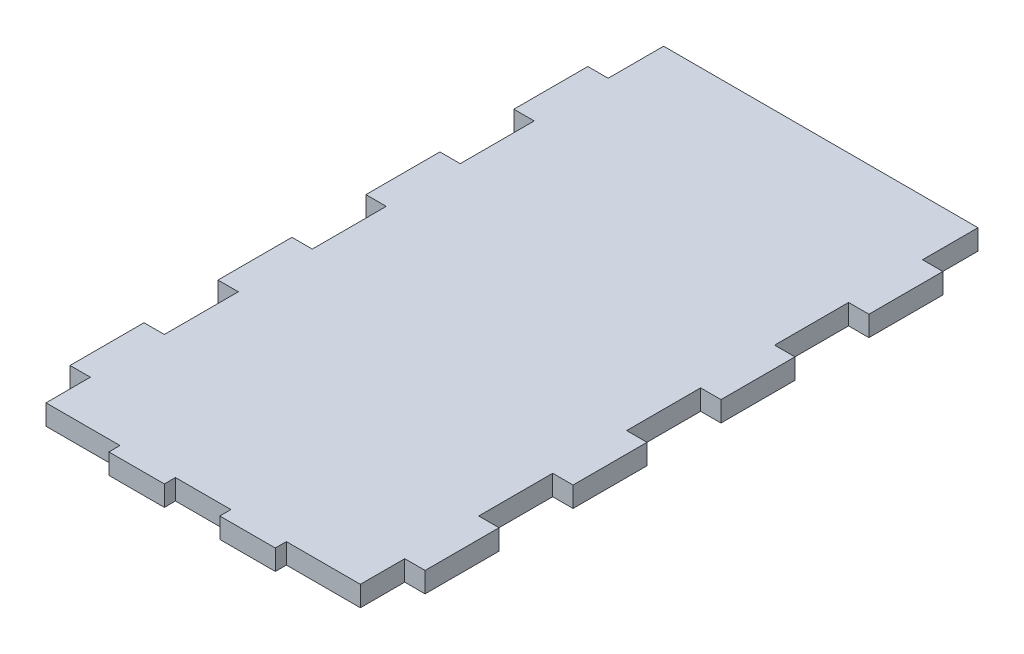
from build123d import *

# Parameters (mm, degrees)
SALIENTE_EXTRUIR1_DEPTH = 5.5


with BuildPart() as part:
    # Croquis1 → Saliente-Extruir1 (new body)
    with BuildSketch(Plane(origin=(0, 0, 0), x_dir=(1, 0, 0), z_dir=(0, 1, 0))):
        Polygon((25.5, 1), (25.5, -2), (40.5, -2), (40.5, 1), (55.5, 1), (55.5, -2), (70.5, -2), (70.5, 1), (90.5, 1), (90.5, 13), (96, 13), (96, 33), (90.5, 33), (90.5, 53), (96, 53), (96, 73), (90.5, 73), (90.5, 93), (96, 93), (96, 113), (90.5, 113), (90.5, 133), (96, 133), (96, 153), (90.5, 153), (90.5, 168), (5.5, 168), (5.5, 153), (0, 153), (0, 133), (5.5, 133), (5.5, 113), (0, 113), (0, 93), (5.5, 93), (5.5, 73), (0, 73), (0, 53), (5.5, 53), (5.5, 33), (0, 33), (0, 13), (5.5, 13), (5.5, 1), align=None)
    extrude(amount=SALIENTE_EXTRUIR1_DEPTH)


solid = part.part
